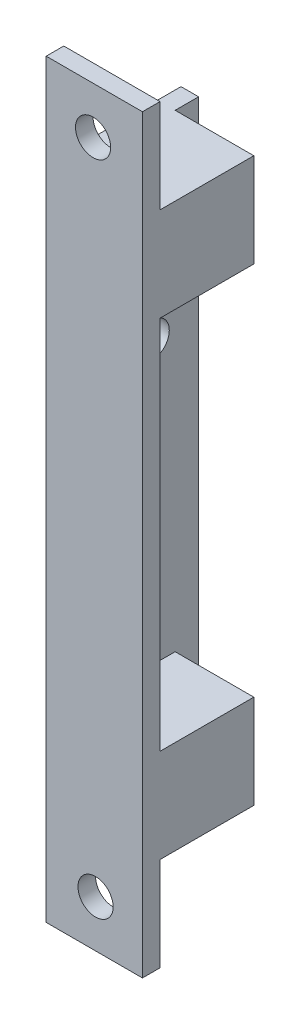
from build123d import *

# Parameters (mm, degrees)
SKETCH2_W           = 31.75
SKETCH2_H           = 152.4
SKETCH2_R           = 4.7625
BOSS_EXTRUDE1_DEPTH = 4.7625
SKETCH3_W           = 26.07038402
SKETCH3_H           = 203.2
SKETCH3_R           = 4.7625
BOSS_EXTRUDE2_DEPTH = 4.7625
SKETCH4_W           = 21.30788402
SKETCH4_H           = 25.4
BOSS_EXTRUDE3_DEPTH = 25.4


with BuildPart() as part:
    # Sketch2 → Boss-Extrude1 (new body)
    with BuildSketch(Plane(origin=(0, 0, 0), x_dir=(0, 0, -1), z_dir=(1, 0, 0))):
        with Locations((15.875, 76.2)):
            Rectangle(SKETCH2_W, SKETCH2_H)
        with Locations((19.05, 101.6)):
            Circle(SKETCH2_R, mode=Mode.SUBTRACT)
    extrude(amount=-BOSS_EXTRUDE1_DEPTH)

    # Sketch3 → Boss-Extrude2 (add)
    with BuildSketch(Plane.XY):
        with Locations((8.27269201, 76.2)):
            Rectangle(SKETCH3_W, SKETCH3_H)
        with Locations((7.9375, 165.1)):
            Circle(SKETCH3_R, mode=Mode.SUBTRACT)
        with Locations((8.60788402, -12.7)):
            Circle(SKETCH3_R, mode=Mode.SUBTRACT)
    extrude(amount=BOSS_EXTRUDE2_DEPTH)

    # Sketch4 → Boss-Extrude3 (add)
    with BuildSketch(Plane(origin=(0, 0, 0), x_dir=(-1, 0, 0), z_dir=(0, 0, -1))):
        with Locations((-10.65394201, 139.7)):
            Rectangle(SKETCH4_W, SKETCH4_H)
        with Locations((-10.65394201, 12.7)):
            Rectangle(SKETCH4_W, SKETCH4_H)
    extrude(amount=BOSS_EXTRUDE3_DEPTH)


solid = part.part
